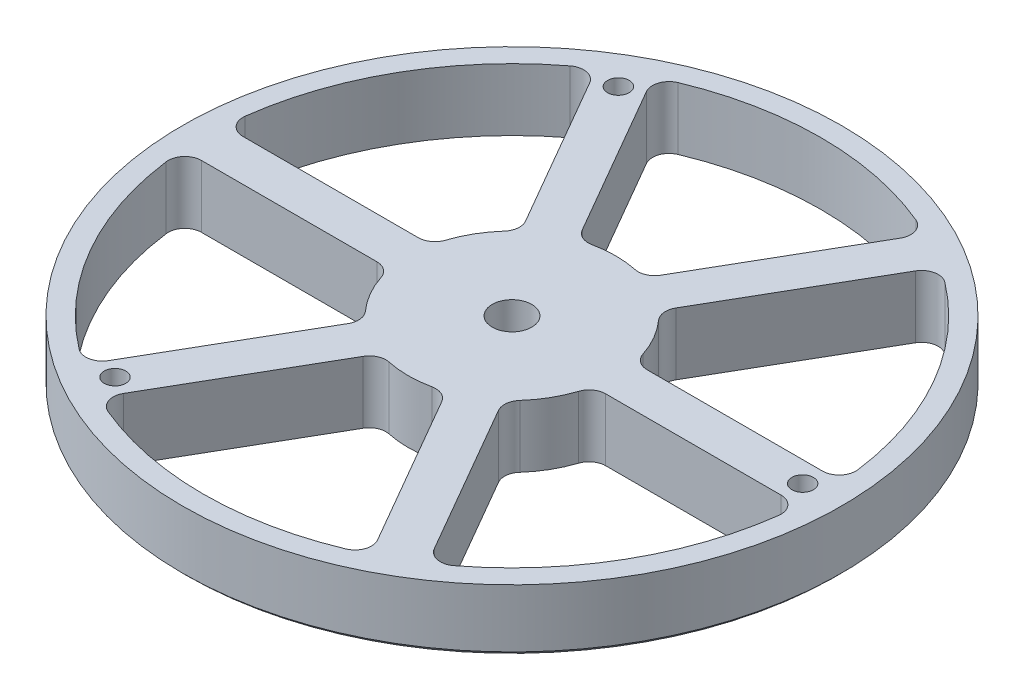
from build123d import *

# Parameters (mm, degrees)
SKETCH2_W                    = 79.375
SKETCH2_H                    = 15
F_6_0_204_DIAMETER_HOLE1_D   = 5.1816
CIRPATTERN3_COUNT            = 3
CUT_EXTRUDE1_DEPTH           = 114.25096578
FILLET1_R                    = 4
CIRPATTERN4_COUNT            = 6
FILLET1_OF_CIRPATTERN4_R     = 4
CHAMFER2_SIZE                = 1
F_3_8_0_375_DIAMETER_HOLE1_D = 9.525


with BuildPart() as part:
    # Sketch2 → Revolve1 (revolve)
    with BuildSketch(Plane(origin=(0, 0, 0), x_dir=(0, 0, -1), z_dir=(1, 0, 0))):
        with Locations((-39.6875, 7.5)):
            Rectangle(SKETCH2_W, SKETCH2_H)
    revolve(axis=Axis((0, -0.75, 0), (0, 1, 0)))

    # #6 (0.204) Diameter Hole1 (through all)
    with Locations(Plane(origin=(0, 15, 0), x_dir=(1, 0, 0), z_dir=(0, 1, 0))):
        with Locations((-35, 60.621778265)):
            f_6_0_204_diameter_hole1 = Hole(F_6_0_204_DIAMETER_HOLE1_D / 2)

    # CirPattern3: #6 (0.204) Diameter Hole1 ×3 about axis
    cirpattern3_axis = Axis((0, -0.75, 0), (0, 1, 0))
    for i in range(1, CIRPATTERN3_COUNT):
        add(f_6_0_204_diameter_hole1.rotate(cirpattern3_axis, i * 360 / CIRPATTERN3_COUNT), mode=Mode.SUBTRACT)

    # Sketch8 → Cut-Extrude1 (cut, through all)
    with BuildSketch(Plane(origin=(0, 15, 0), x_dir=(1, 0, 0), z_dir=(0, 1, 0))):
        with BuildLine():
            Line((-7.917321695, 23.713203436), (-32.773244206, 66.764924094))
            ThreePointArc((-32.773244206, 66.764924094), (0, 74.375), (32.773244206, 66.764924094))
            Line((32.773244206, 66.764924094), (7.917321695, 23.713203436))
            ThreePointArc((7.917321695, 23.713203436), (0, 25), (-7.917321695, 23.713203436))
        make_face()
    cut_extrude1 = extrude(amount=-CUT_EXTRUDE1_DEPTH, mode=Mode.SUBTRACT)

    # Fillet1
    fillet1_edges = [part.edges().sort_by_distance(p)[0] for p in [
        (7.917321695, 7.5, -23.713203436),
        (32.773244206, 7.5, -66.764924094),
        (-7.917321695, 7.5, -23.713203436),
        (-32.773244206, 7.5, -66.764924094),
    ]]
    fillet(fillet1_edges, radius=FILLET1_R)

    # CirPattern4: Cut-Extrude1 ×6 about axis
    cirpattern4_axis = Axis((0, -0.75, 0), (0, 1, 0))
    for i in range(1, CIRPATTERN4_COUNT):
        add(cut_extrude1.rotate(cirpattern4_axis, i * 360 / CIRPATTERN4_COUNT), mode=Mode.SUBTRACT)

    # Fillet1 of CirPattern4
    fillet1_of_cirpattern4_edges = [part.edges().sort_by_distance(p)[0] for p in [
        (-16.577575733, 7.5, -18.713203436),
        (-41.433498244, 7.5, -61.764924094),
        (-24.494897428, 7.5, -5),
        (-74.20674245, 7.5, -5),
        (-24.494897428, 7.5, 5),
        (-74.20674245, 7.5, 5),
        (-16.577575733, 7.5, 18.713203436),
        (-41.433498244, 7.5, 61.764924094),
        (-7.917321695, 7.5, 23.713203436),
        (-32.773244206, 7.5, 66.764924094),
        (7.917321695, 7.5, 23.713203436),
        (32.773244206, 7.5, 66.764924094),
        (16.577575733, 7.5, 18.713203436),
        (41.433498244, 7.5, 61.764924094),
        (24.494897428, 7.5, 5),
        (74.20674245, 7.5, 5),
        (24.494897428, 7.5, -5),
        (74.20674245, 7.5, -5),
        (16.577575733, 7.5, -18.713203436),
        (41.433498244, 7.5, -61.764924094),
    ]]
    fillet(fillet1_of_cirpattern4_edges, radius=FILLET1_OF_CIRPATTERN4_R)

    # Chamfer2
    chamfer2_edges = [part.edges().sort_by_distance(p)[0] for p in [
        (0, 0, -79.375),
    ]]
    chamfer(chamfer2_edges, length=CHAMFER2_SIZE)

    # 3/8 (0.375) Diameter Hole1 (through all)
    with Locations(Plane(origin=(0, 0, 0), x_dir=(-1, 0, 0), z_dir=(0, -1, 0))):
        with Locations((0, 0)):
            Hole(F_3_8_0_375_DIAMETER_HOLE1_D / 2)


solid = part.part
